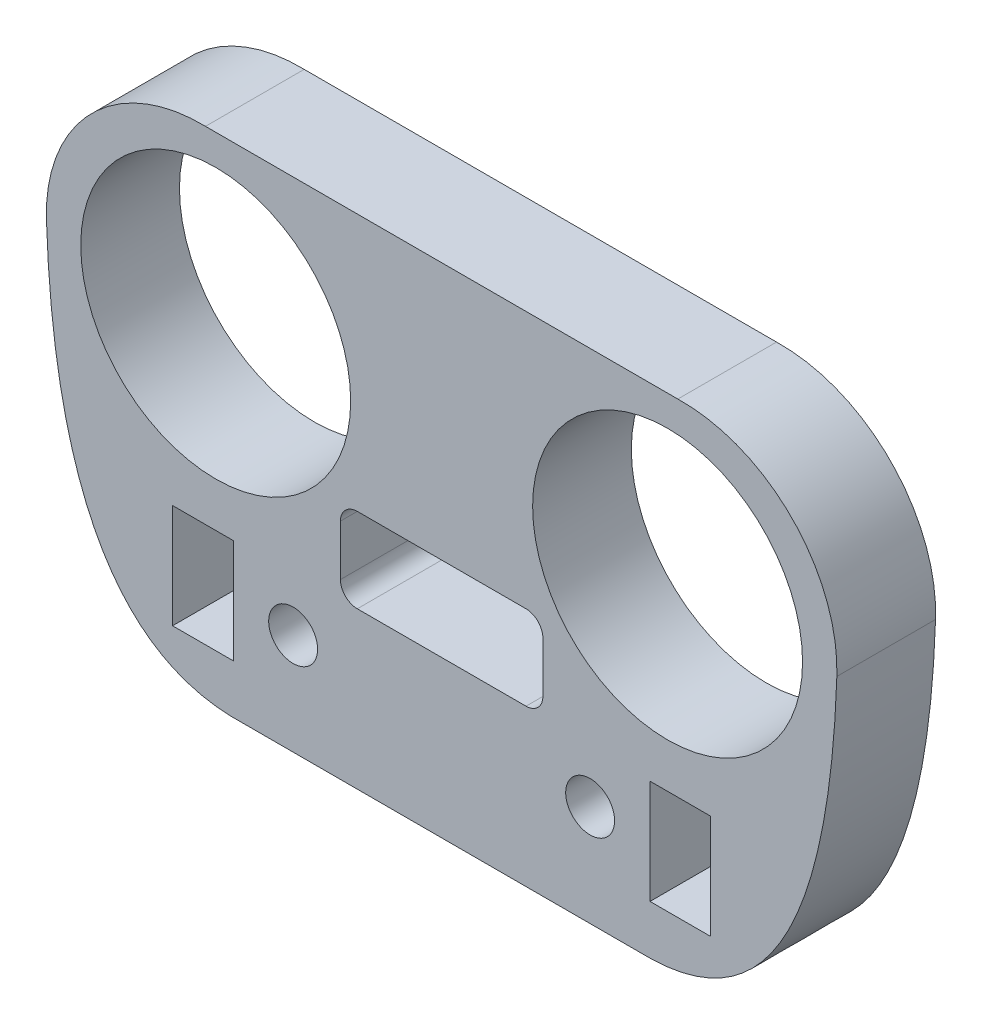
from build123d import *

# Parameters (mm, degrees)
MODEL_W             = 3.6
MODEL_H             = 6.173462
MODEL_R             = 1.449812935
MODEL_R_2           = 7.999917631
BOSS_EXTRUDE1_DEPTH = 5.85


with BuildPart() as part:
    # Model → Boss-Extrude1 (new body)
    with BuildSketch(Plane.XY):
        with BuildLine():
            Line((568.674763139, 594.599966993), (540.677443159, 594.599966993))
            ThreePointArc((540.677443159, 594.599966993), (533.909979714, 591.869304693), (531.251426748, 585.073190054))
            add(Edge.make_bspline(
                [(531.251426748, 585.073190054), (531.926909632, 565.393042288), (542.192175731, 565.073190054)],
                knots=[0, 0, 0, 1, 1, 1], degree=2))
            Line((542.192175731, 565.073190054), (567.160030567, 565.073190054))
            add(Edge.make_bspline(
                [(578.10077955, 585.073190054), (577.425296665, 565.393042288), (567.160030567, 565.073190054)],
                knots=[0, 0, 0, 1, 1, 1], degree=2))
            ThreePointArc((578.10077955, 585.073190054), (575.442226583, 591.869304693), (568.674763139, 594.599966993))
        make_face()
        with Locations((540.525835586, 571.073190054)):
            Rectangle(MODEL_W, MODEL_H, mode=Mode.SUBTRACT)
        with Locations((545.873791214, 571.073190054)):
            Circle(MODEL_R, mode=Mode.SUBTRACT)
        with BuildLine():
            Line((554.676103149, 574.334674665), (549.676103149, 574.334674665))
            ThreePointArc((549.676103149, 574.334674665), (548.968996368, 574.627567884), (548.676103149, 575.334674665))
            Line((548.676103149, 575.334674665), (548.676103149, 578.334674665))
            ThreePointArc((548.676103149, 578.334674665), (548.968996368, 579.041781446), (549.676103149, 579.334674665))
            Line((549.676103149, 579.334674665), (554.676103149, 579.334674665))
            Line((554.676103149, 579.334674665), (559.676103149, 579.334674665))
            ThreePointArc((559.676103149, 579.334674665), (560.38320993, 579.041781446), (560.676103149, 578.334674665))
            Line((560.676103149, 578.334674665), (560.676103149, 575.334674665))
            ThreePointArc((560.676103149, 575.334674665), (560.38320993, 574.627567884), (559.676103149, 574.334674665))
            Line((559.676103149, 574.334674665), (554.676103149, 574.334674665))
        make_face(mode=Mode.SUBTRACT)
        with Locations((563.478415084, 571.073190054)):
            Circle(MODEL_R, mode=Mode.SUBTRACT)
        with Locations((568.826370712, 571.073190054)):
            Rectangle(MODEL_W, MODEL_H, mode=Mode.SUBTRACT)
        with Locations((541.283961295, 584.797511369)):
            Circle(MODEL_R_2, mode=Mode.SUBTRACT)
        with Locations((568.068245003, 584.797511369)):
            Circle(MODEL_R_2, mode=Mode.SUBTRACT)
    extrude(amount=BOSS_EXTRUDE1_DEPTH)


solid = part.part
